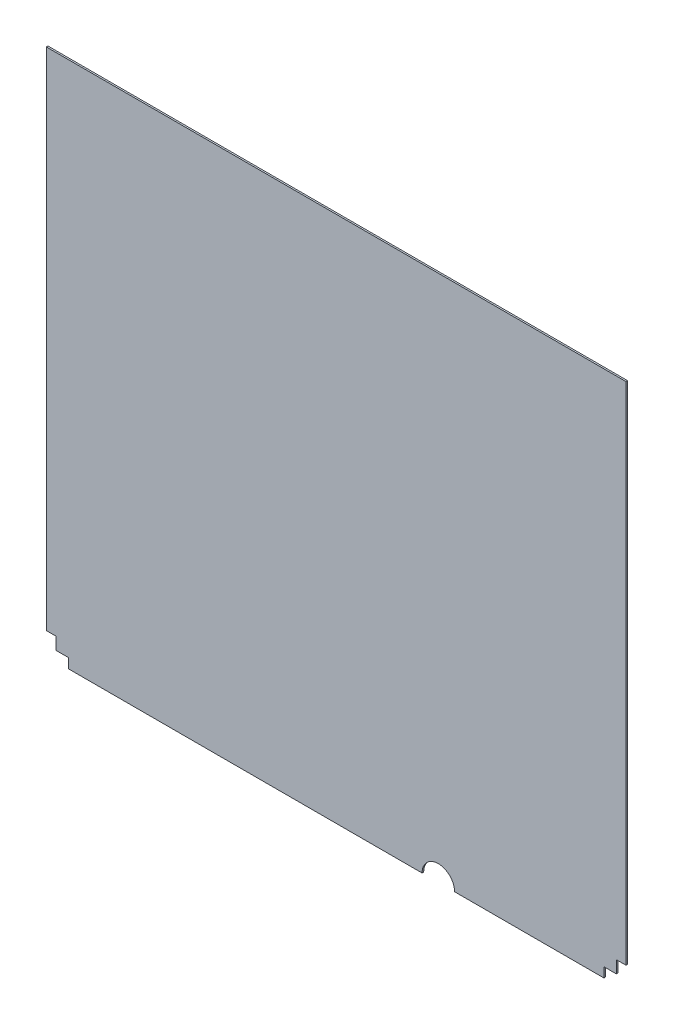
from build123d import *

# Parameters (mm, degrees)
BOSS_EXTRUDE1_DEPTH = 2.54


with BuildPart() as part:
    # Sketch1 → Boss-Extrude1 (new body)
    with BuildSketch(Plane.XY):
        with BuildLine():
            Line((0, 825.5), (0, 34.544))
            Line((0, 34.544), (15.24, 34.544))
            Line((15.24, 34.544), (15.24, 15.24))
            Line((15.24, 15.24), (34.544, 15.24))
            Line((34.544, 15.24), (34.544, 0))
            Line((34.544, 0), (587.904273944, 0))
            ThreePointArc((587.904273944, 0), (613.304273944, 25.4), (638.704273944, 0))
            Line((638.704273944, 0), (872.45698, 0))
            Line((872.45698, 0), (872.45698, 15.24))
            Line((872.45698, 15.24), (891.76098, 15.24))
            Line((891.76098, 15.24), (891.76098, 34.544))
            Line((891.76098, 34.544), (907.00098, 34.544))
            Line((907.00098, 34.544), (907.00098, 825.5))
            Line((907.00098, 825.5), (0, 825.5))
        make_face()
    extrude(amount=BOSS_EXTRUDE1_DEPTH)


solid = part.part
